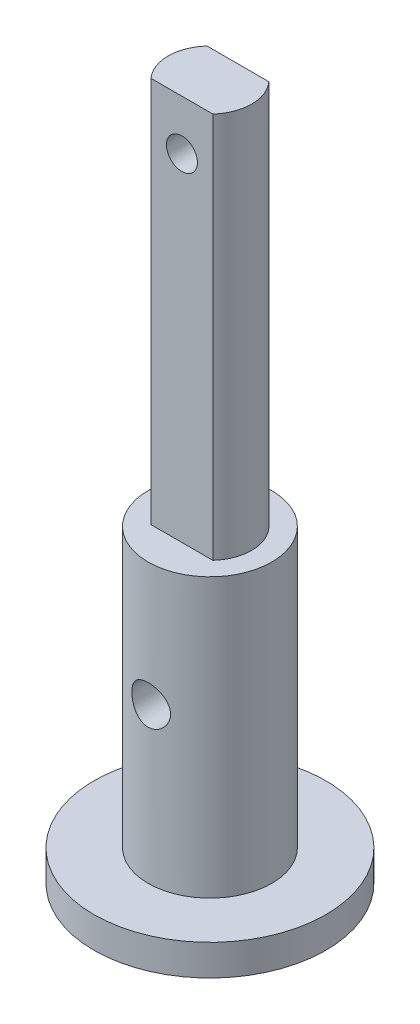
from build123d import *

# Parameters (mm, degrees)
SKETCH1_R               = 7.5
SKETCH1_R_2             = 4
BOSS_EXTRUDE1_DEPTH     = 2
SKETCH1_2_R             = 4
BOSS_EXTRUDE2_DEPTH     = 45
SKETCH2_R               = 4.5
CUT_EXTRUDE1_DEPTH      = 25
CUT_EXTRUDE2_DEPTH      = 25
CUT_EXTRUDE2_DEPTH_BACK = 25
SKETCH3_R               = 1
SKETCH3_R_2             = 1.25


with BuildPart() as part:
    # Sketch1 → Boss-Extrude1 (new body)
    with BuildSketch(Plane(origin=(0, 0, 0), x_dir=(1, 0, 0), z_dir=(0, 1, 0))):
        Circle(SKETCH1_R)
        Circle(SKETCH1_R_2, mode=Mode.SUBTRACT)
    extrude(amount=BOSS_EXTRUDE1_DEPTH)

    # Sketch1<2> → Boss-Extrude2 (add)
    with BuildSketch(Plane(origin=(0, 0, 0), x_dir=(1, 0, 0), z_dir=(0, 1, 0))):
        Circle(SKETCH1_2_R)
    extrude(amount=BOSS_EXTRUDE2_DEPTH)

    # Sketch2 → Cut-Extrude1 (cut)
    with BuildSketch(Plane(origin=(0, 45, 0), x_dir=(1, 0, 0), z_dir=(0, 1, 0))):
        Circle(SKETCH2_R)
        with BuildLine():
            Line((-2, 1.811376185), (2, 1.811376185))
            ThreePointArc((2, 1.811376185), (2.698348325, 0), (2, -1.811376185))
            Line((2, -1.811376185), (-2, -1.811376185))
            ThreePointArc((-2, -1.811376185), (-2.698348325, 0), (-2, 1.811376185))
        make_face(mode=Mode.SUBTRACT)
    extrude(amount=-CUT_EXTRUDE1_DEPTH, mode=Mode.SUBTRACT)

    # Sketch3 → Cut-Extrude2 (cut, two sides: drawn at the far end of the back side and taken through both)
    with BuildSketch(Plane(origin=(0, 0, -1.811376185), x_dir=(-1, 0, 0), z_dir=(0, 0, -1)).offset(-CUT_EXTRUDE2_DEPTH_BACK)):
        with Locations((0, 41.77819729)):
            Circle(SKETCH3_R)
        with Locations((0, 12)):
            Circle(SKETCH3_R_2)
    extrude(amount=CUT_EXTRUDE2_DEPTH + CUT_EXTRUDE2_DEPTH_BACK, mode=Mode.SUBTRACT)


solid = part.part
